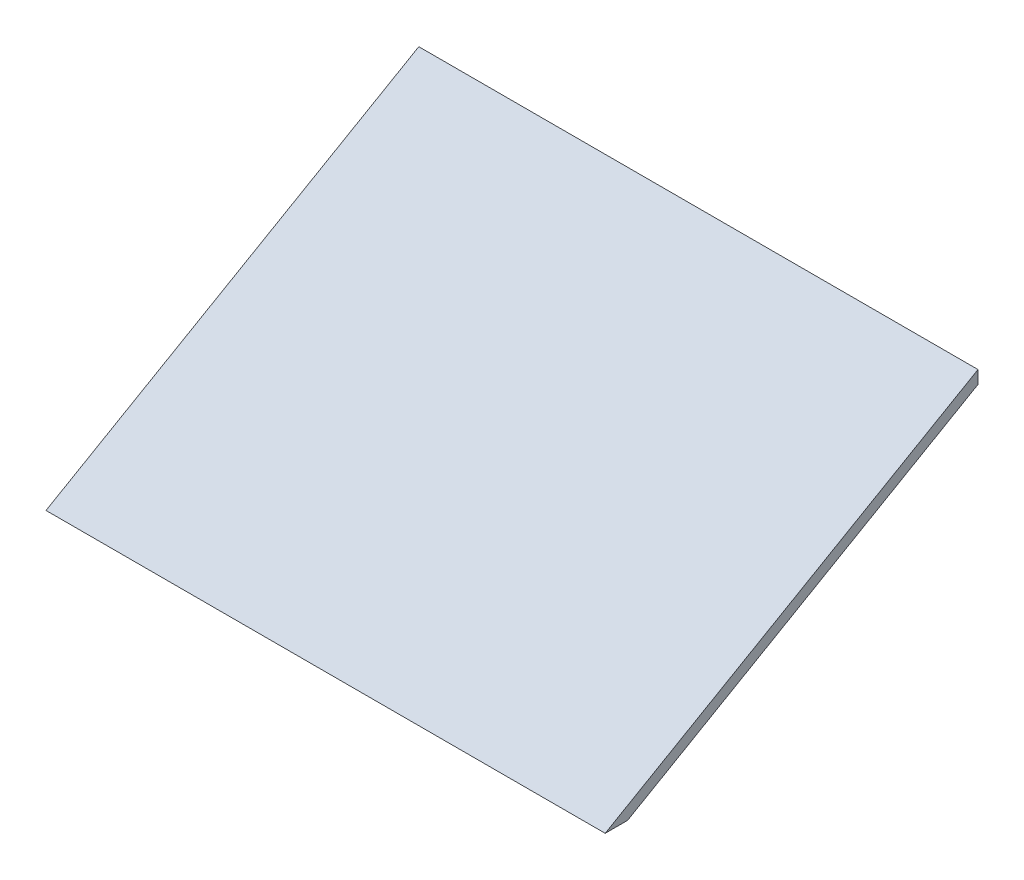
from build123d import *

# Parameters (mm, degrees)
BOSS_EXTRUDE1_DEPTH = 150


with BuildPart() as part:
    # Sketch1 → Boss-Extrude1 (new body)
    with BuildSketch(Plane(origin=(0, 0, 0), x_dir=(0, 0, -1), z_dir=(1, 0, 0))):
        Polygon((0, 0), (-94, -54.270925304), (-100, -54.270925304), (0, 3.464101615), align=None)
    extrude(amount=BOSS_EXTRUDE1_DEPTH)


solid = part.part
